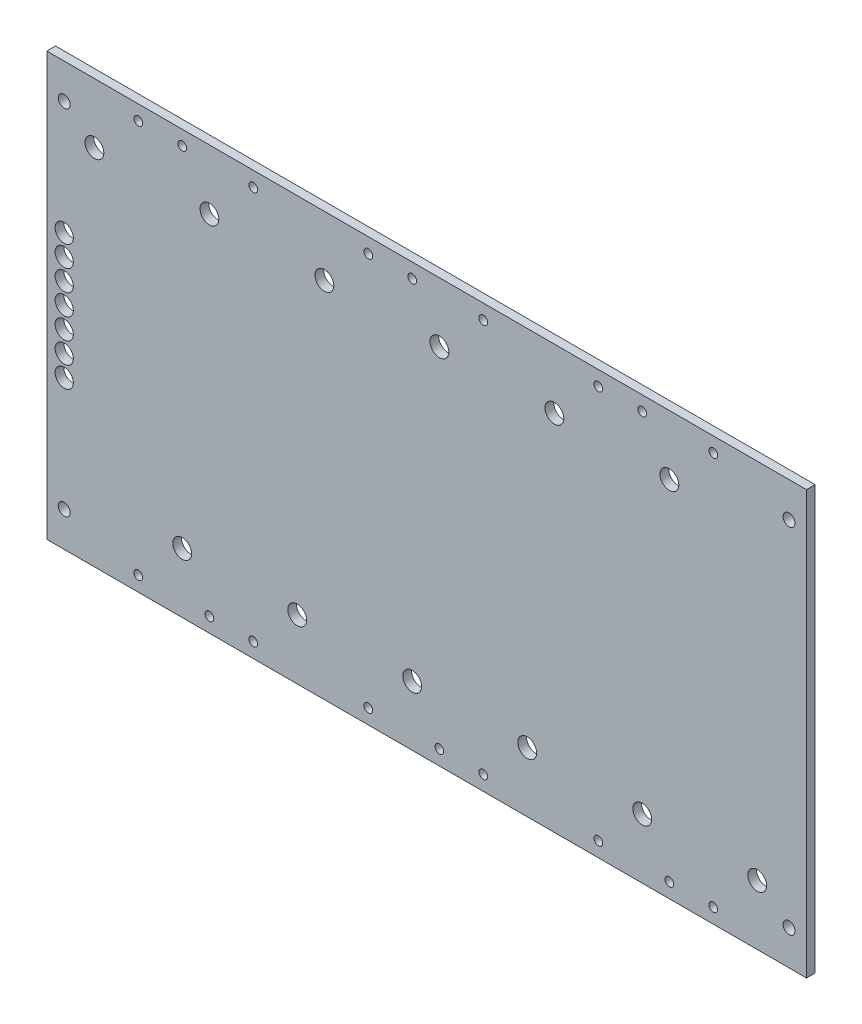
from build123d import *

# Parameters (mm, degrees)
SKETCH1_R           = 0.79375
SKETCH1_R_2         = 1.0922
SKETCH1_R_3         = 1.7145
SKETCH1_R_4         = 1.659299133
BOSS_EXTRUDE1_DEPTH = 1.5875


with BuildPart() as part:
    # Sketch1 → Boss-Extrude1 (new body)
    with BuildSketch(Plane.XY):
        Polygon((-6.35, 0), (0, 0), (132.08, 0), (132.08, 77.0636), (0, 77.0636), (-6.35, 77.0636), align=None)
        with Locations((10.3251, 2.6924)):
            Circle(SKETCH1_R, mode=Mode.SUBTRACT)
        with Locations((-3.175, 6.35)):
            Circle(SKETCH1_R_2, mode=Mode.SUBTRACT)
        with Locations((23.2791, 2.6924)):
            Circle(SKETCH1_R, mode=Mode.SUBTRACT)
        with Locations((18.3261, 10.9093)):
            Circle(SKETCH1_R_3, mode=Mode.SUBTRACT)
        with Locations((31.2801, 2.6924)):
            Circle(SKETCH1_R, mode=Mode.SUBTRACT)
        with Locations((52.2351, 2.6924)):
            Circle(SKETCH1_R, mode=Mode.SUBTRACT)
        with Locations((39.2811, 10.9093)):
            Circle(SKETCH1_R_3, mode=Mode.SUBTRACT)
        with Locations((60.2361, 10.9093)):
            Circle(SKETCH1_R_3, mode=Mode.SUBTRACT)
        with Locations((-3.175, 27.1018)):
            Circle(SKETCH1_R_4, mode=Mode.SUBTRACT)
        with Locations((-3.175, 30.9118)):
            Circle(SKETCH1_R_4, mode=Mode.SUBTRACT)
        with Locations((-3.175, 34.7218)):
            Circle(SKETCH1_R_4, mode=Mode.SUBTRACT)
        with Locations((65.1891, 2.6924)):
            Circle(SKETCH1_R, mode=Mode.SUBTRACT)
        with Locations((73.1901, 2.6924)):
            Circle(SKETCH1_R, mode=Mode.SUBTRACT)
        with Locations((94.1451, 2.6924)):
            Circle(SKETCH1_R, mode=Mode.SUBTRACT)
        with Locations((81.1911, 10.9093)):
            Circle(SKETCH1_R_3, mode=Mode.SUBTRACT)
        with Locations((107.0991, 2.6924)):
            Circle(SKETCH1_R, mode=Mode.SUBTRACT)
        with Locations((115.1001, 2.6924)):
            Circle(SKETCH1_R, mode=Mode.SUBTRACT)
        with Locations((128.905, 6.35)):
            Circle(SKETCH1_R_2, mode=Mode.SUBTRACT)
        with Locations((102.1461, 10.9093)):
            Circle(SKETCH1_R_3, mode=Mode.SUBTRACT)
        with Locations((123.1011, 10.9093)):
            Circle(SKETCH1_R_3, mode=Mode.SUBTRACT)
        with Locations((-3.175, 38.5318)):
            Circle(SKETCH1_R_4, mode=Mode.SUBTRACT)
        with Locations((-3.175, 42.3418)):
            Circle(SKETCH1_R_4, mode=Mode.SUBTRACT)
        with Locations((-3.175, 46.1518)):
            Circle(SKETCH1_R_4, mode=Mode.SUBTRACT)
        with Locations((-3.175, 49.9618)):
            Circle(SKETCH1_R_4, mode=Mode.SUBTRACT)
        with Locations((2.3241, 66.1543)):
            Circle(SKETCH1_R_3, mode=Mode.SUBTRACT)
        with Locations((23.2791, 66.1543)):
            Circle(SKETCH1_R_3, mode=Mode.SUBTRACT)
        with Locations((-3.175, 70.7136)):
            Circle(SKETCH1_R_2, mode=Mode.SUBTRACT)
        with Locations((10.3251, 74.3712)):
            Circle(SKETCH1_R, mode=Mode.SUBTRACT)
        with Locations((18.3261, 74.4347)):
            Circle(SKETCH1_R, mode=Mode.SUBTRACT)
        with Locations((44.2341, 66.1543)):
            Circle(SKETCH1_R_3, mode=Mode.SUBTRACT)
        with Locations((31.2801, 74.3712)):
            Circle(SKETCH1_R, mode=Mode.SUBTRACT)
        with Locations((52.2351, 74.3712)):
            Circle(SKETCH1_R, mode=Mode.SUBTRACT)
        with Locations((60.2361, 74.4347)):
            Circle(SKETCH1_R, mode=Mode.SUBTRACT)
        with Locations((65.1891, 66.1543)):
            Circle(SKETCH1_R_3, mode=Mode.SUBTRACT)
        with Locations((86.1441, 66.1543)):
            Circle(SKETCH1_R_3, mode=Mode.SUBTRACT)
        with Locations((73.1901, 74.3712)):
            Circle(SKETCH1_R, mode=Mode.SUBTRACT)
        with Locations((94.1451, 74.3712)):
            Circle(SKETCH1_R, mode=Mode.SUBTRACT)
        with Locations((107.0991, 66.1543)):
            Circle(SKETCH1_R_3, mode=Mode.SUBTRACT)
        with Locations((102.1461, 74.4347)):
            Circle(SKETCH1_R, mode=Mode.SUBTRACT)
        with Locations((128.905, 70.7136)):
            Circle(SKETCH1_R_2, mode=Mode.SUBTRACT)
        with Locations((115.1001, 74.3712)):
            Circle(SKETCH1_R, mode=Mode.SUBTRACT)
    extrude(amount=BOSS_EXTRUDE1_DEPTH)


solid = part.part
